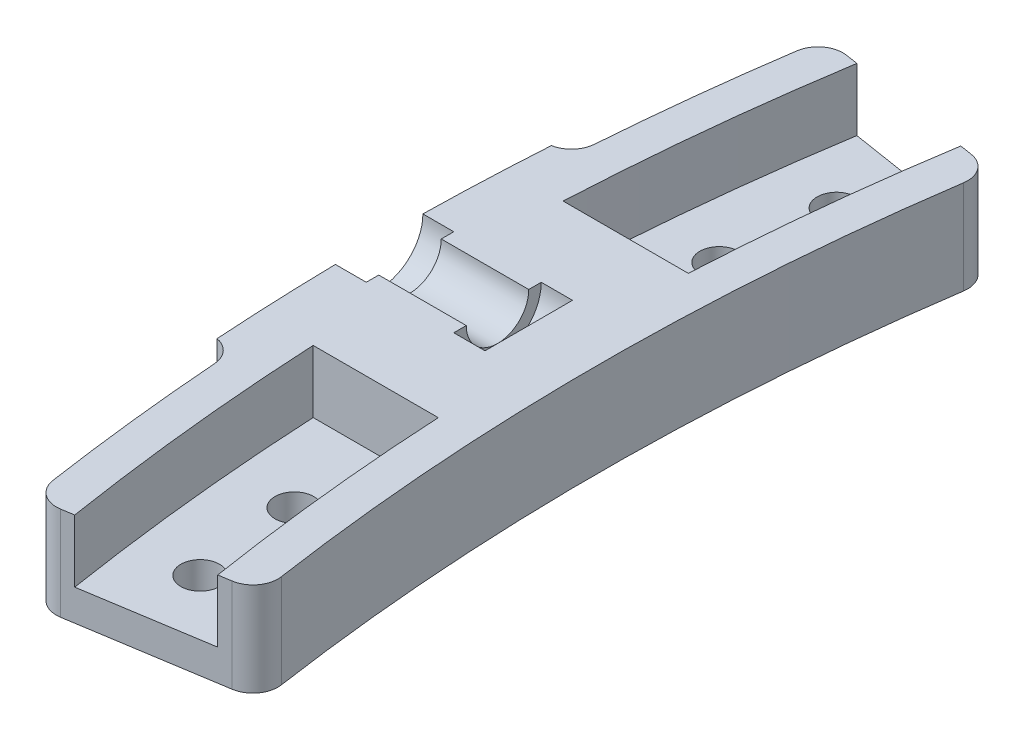
from build123d import *

# Parameters (mm, degrees)
BOSS_EXTRUDE1_DEPTH        = 7.5
BOSS_EXTRUDE2_DEPTH        = 7.5
CUT_EXTRUDE1_DEPTH         = 5
F_3_1_3_1_DIAMETER_HOLE2_D = 3.1
SKETCH21_R                 = 3.5
CUT_EXTRUDE2_DEPTH         = 2.5
CUT_EXTRUDE3_START         = 2.5
SKETCH23_R                 = 3.5
CUT_EXTRUDE3_DEPTH         = 2.5
SKETCH22_R                 = 2.5
CUT_EXTRUDE4_DEPTH         = 35.217583069
FILLET1_R                  = 2
FILLET2_R                  = 2


with BuildPart() as part:
    # Sketch1 → Boss-Extrude1 (new body)
    with BuildSketch(Plane(origin=(0, 0, 0), x_dir=(1, 0, 0), z_dir=(0, 1, 0))):
        with BuildLine():
            ThreePointArc((-187.660784713, 29.722548358), (-190, 0), (-187.660784713, -29.722548358))
            Line((-187.660784713, -29.722548358), (-197.537668119, -31.286893008))
            ThreePointArc((-197.537668119, -31.286893008), (-200, 0), (-197.537668119, 31.286893008))
            Line((-197.537668119, 31.286893008), (-187.660784713, 29.722548358))
        make_face()
        with BuildLine():
            ThreePointArc((-197.537668119, -31.286893008), (-200, 0), (-197.537668119, 31.286893008))
            Line((-197.537668119, 31.286893008), (-200.500733141, 31.756196403))
            ThreePointArc((-200.500733141, 31.756196403), (-203, 0), (-200.500733141, -31.756196403))
            Line((-200.500733141, -31.756196403), (-197.537668119, -31.286893008))
        make_face()
        with BuildLine():
            Line((-184.697719691, 29.253244963), (-187.660784713, 29.722548358))
            ThreePointArc((-187.660784713, 29.722548358), (-190, 0), (-187.660784713, -29.722548358))
            Line((-187.660784713, -29.722548358), (-184.697719691, -29.253244963))
            ThreePointArc((-184.697719691, -29.253244963), (-187, 0), (-184.697719691, 29.253244963))
        make_face()
    extrude(amount=BOSS_EXTRUDE1_DEPTH)

    # Sketch19 → Boss-Extrude2 (add)
    with BuildSketch(Plane(origin=(0, 0, 0), x_dir=(1, 0, 0), z_dir=(0, 1, 0))):
        with BuildLine():
            Line((-204.062149802, 13.374939928), (-202.565361417, 13.276835234))
            ThreePointArc((-202.565361417, 13.276835234), (-203, 0), (-202.565361417, -13.276835234))
            Line((-202.565361417, -13.276835234), (-204.062149802, -13.374939928))
            ThreePointArc((-204.062149802, -13.374939928), (-204.5, 0), (-204.062149802, 13.374939928))
        make_face()
    extrude(amount=BOSS_EXTRUDE2_DEPTH)

    # Sketch15 → Cut-Extrude1 (cut)
    with BuildSketch(Plane(origin=(0, 7.5, 0), x_dir=(1, 0, 0), z_dir=(0, 1, 0))):
        with BuildLine():
            Line((-199.749843554, 10), (-189.73665961, 10))
            ThreePointArc((-189.73665961, 10), (-188.956218405, 19.88837666), (-187.660784713, 29.722548358))
            Line((-187.660784713, 29.722548358), (-197.537668119, 31.286893008))
            ThreePointArc((-197.537668119, 31.286893008), (-198.928692466, 20.673057674), (-199.749843554, 10))
        make_face()
        with BuildLine():
            ThreePointArc((-187.660784713, -29.722548358), (-188.956218405, -19.88837666), (-189.73665961, -10))
            Line((-189.73665961, -10), (-199.749843554, -10))
            ThreePointArc((-199.749843554, -10), (-198.928692466, -20.673057674), (-197.537668119, -31.286893008))
            Line((-197.537668119, -31.286893008), (-187.660784713, -29.722548358))
        make_face()
    extrude(amount=-CUT_EXTRUDE1_DEPTH, mode=Mode.SUBTRACT)

    # Ø3.1 (3.1) Diameter Hole2 (through all)
    with Locations(Plane(origin=(0, 0, 0), x_dir=(-1, 0, 0), z_dir=(0, -1, 0))):
        with Locations((193.331747968, -25.452607483), (194.257966128, -16.995369836), (194.257966128, 16.995369836), (193.331747968, 25.452607483)):
            Hole(F_3_1_3_1_DIAMETER_HOLE2_D / 2)

    # Sketch21 → Cut-Extrude2 (cut)
    with BuildSketch(Plane(origin=(-192.5, 0, 0), x_dir=(0, 0, -1), z_dir=(1, 0, 0))):
        with Locations((0, 7.5)):
            Circle(SKETCH21_R)
    extrude(amount=-CUT_EXTRUDE2_DEPTH, mode=Mode.SUBTRACT)

    # Sketch23 → Cut-Extrude3 (cut)
    with BuildSketch(Plane(origin=(-204.5, 0, 0), x_dir=(0, 0, -1), z_dir=(1, 0, 0)).offset(CUT_EXTRUDE3_START)):
        with Locations((0, 7.5)):
            Circle(SKETCH23_R)
    extrude(amount=-CUT_EXTRUDE3_DEPTH, mode=Mode.SUBTRACT)

    # Sketch22 → Cut-Extrude4 (cut, through all)
    with BuildSketch(Plane(origin=(-195, 0, 0), x_dir=(0, 0, -1), z_dir=(1, 0, 0))):
        with Locations((0, 7.5)):
            Circle(SKETCH22_R)
    extrude(amount=-CUT_EXTRUDE4_DEPTH, mode=Mode.SUBTRACT)

    # Fillet1
    fillet1_edges = [part.edges().sort_by_distance(p)[0] for p in [
        (-200.500733141, 3.75, 31.756196403),
        (-200.500733141, 3.75, -31.756196403),
        (-184.697719691, 3.75, -29.253244963),
        (-184.697719691, 3.75, 29.253244963),
    ]]
    fillet(fillet1_edges, radius=FILLET1_R)

    # Fillet2
    # the kernel refuses this fillet: 2 mm, written as the material it adds along each edge
    with BuildSketch(Plane(origin=(-202.565361417, 0, -13.276835234), x_dir=(0.0701211938680431, 0, -0.9975384795437819), z_dir=(0, 1, 0))) as fillet2_piece_1:
        with BuildLine():
            CenterArc((1.929399735, 1.999977637), FILLET2_R, 194.477346772, 75.251705008)
            Line((-0.007093381, 1.499983228), (-0.045823244, 1.48998334))
            ThreePointArc((-0.045823244, 1.48998334), (-0.043546243, 0.749802457), (-0.039999553, -0.000189157))
            Line((-0.039999553, -0.000189157), (0.000189157, -0.039999553))
            ThreePointArc((0.000189157, -0.039999553), (0.959970947, -0.037730174), (1.919752737, -0.039999553))
            Line((1.919752737, -0.039999553), (1.919941893, 0))
        make_face()
    extrude(amount=7.5)
    with BuildSketch(Plane(origin=(-202.565361417, 0, 13.276835234), x_dir=(-0.9978589232386035, 0, 0.06540312923014294), z_dir=(0, 1, 0))) as fillet2_piece_2:
        with BuildLine():
            CenterArc((1.990831296, 1.938835898), FILLET2_R, 180.54189644, 75.251705008)
            Line((-0.009079253, 1.919920426), (-0.049077464, 1.919542116))
            ThreePointArc((-0.049077464, 1.919542116), (-0.042269379, 0.95978179), (-0.04, 0))
            Line((-0.04, 0), (0, -0.04))
            ThreePointArc((0, -0.04), (0.75, -0.04), (1.490183374, -0.038776718))
            Line((1.490183374, -0.038776718), (1.5, 0))
        make_face()
    extrude(amount=7.5)


solid = part.part
